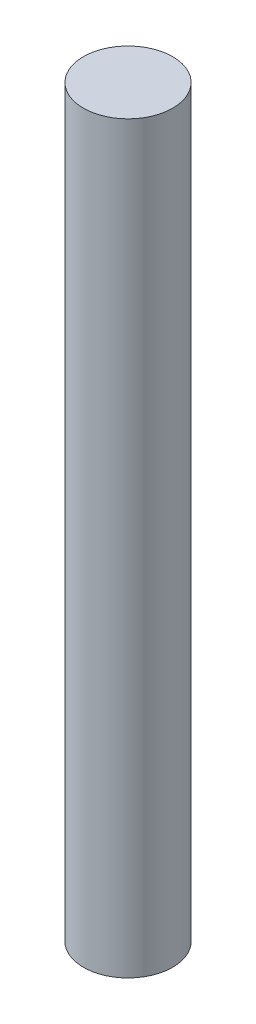
from build123d import *

# Parameters (mm, degrees)
SKETCH1_W = 1.5
SKETCH1_H = 25


with BuildPart() as part:
    # Sketch1 → Revolve1 (revolve)
    with BuildSketch(Plane.XY):
        with Locations((-0.75, 12.5)):
            Rectangle(SKETCH1_W, SKETCH1_H)
    revolve(axis=Axis((0, 0, 0), (0, 1, 0)))


solid = part.part
